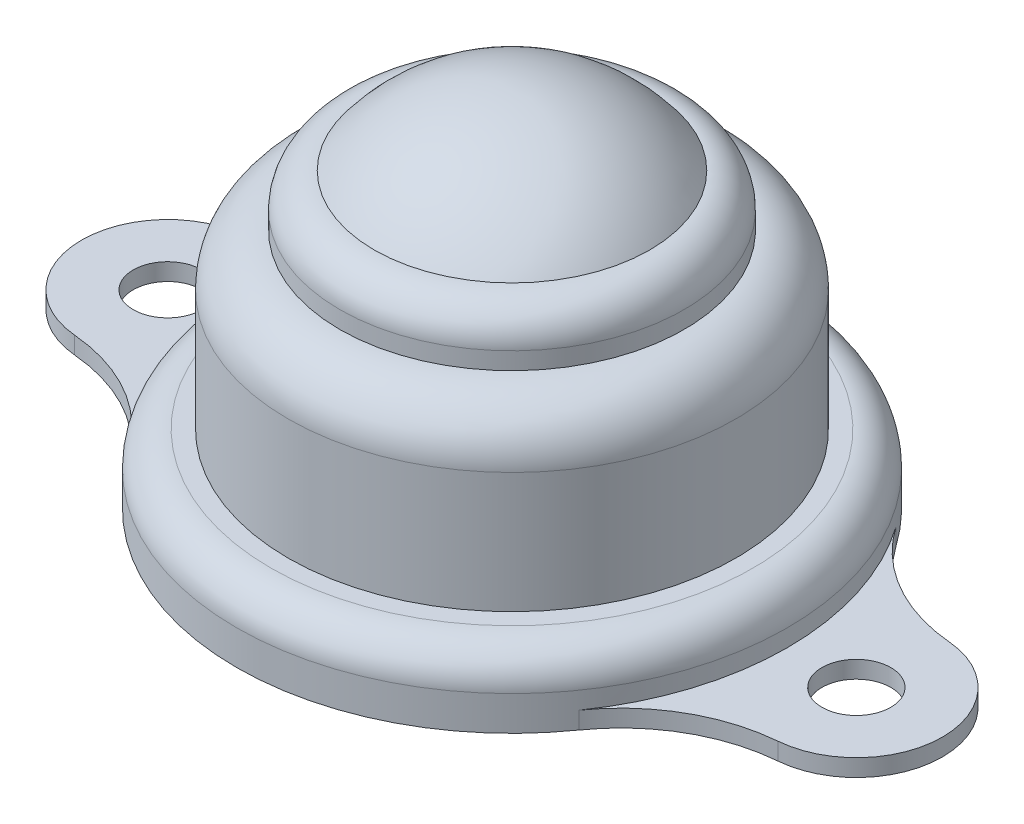
from build123d import *

# Parameters (mm, degrees)
SKETCH1_R           = 2
BOSS_EXTRUDE1_DEPTH = 1
SKETCH2_R           = 16
SKETCH2_R_2         = 13
BOSS_EXTRUDE2_DEPTH = 3
FILLET2_R           = 2
SKETCH3_R           = 13
SKETCH3_R_2         = 10
BOSS_EXTRUDE3_DEPTH = 10
SKETCH4_R           = 10
SKETCH4_R_2         = 8
BOSS_EXTRUDE4_DEPTH = 3
FILLET3_R           = 2
FILLET4_R           = 3


with BuildPart() as part:
    # Sketch1 → Boss-Extrude1 (new body)
    with BuildSketch(Plane(origin=(0, 0, 0), x_dir=(1, 0, 0), z_dir=(0, 1, 0))):
        with BuildLine():
            ThreePointArc((-20.425, 4.981904756), (-25, 0), (-20.425, -4.981904756))
            ThreePointArc((-20.425, -4.981904756), (-16.291035329, -6.276222002), (-13.092307692, -9.197362627))
            ThreePointArc((-13.092307692, -9.197362627), (0, -16), (13.092307692, -9.197362627))
            ThreePointArc((13.092307692, -9.197362627), (16.291035329, -6.276222002), (20.425, -4.981904756))
            ThreePointArc((20.425, -4.981904756), (25, 0), (20.425, 4.981904756))
            ThreePointArc((20.425, 4.981904756), (16.291035329, 6.276222002), (13.092307692, 9.197362627))
            ThreePointArc((13.092307692, 9.197362627), (0, 16), (-13.092307692, 9.197362627))
            ThreePointArc((-13.092307692, 9.197362627), (-16.291035329, 6.276222002), (-20.425, 4.981904756))
        make_face()
        with Locations(Location((-20, 0, 0), (0, 0, 270))):
            Circle(SKETCH1_R, mode=Mode.SUBTRACT)
        with Locations(Location((20, 0, 0), (0, 0, 270))):
            Circle(SKETCH1_R, mode=Mode.SUBTRACT)
    extrude(amount=BOSS_EXTRUDE1_DEPTH)

    # Sketch2 → Boss-Extrude2 (add)
    with BuildSketch(Plane(origin=(0, 1, 0), x_dir=(1, 0, 0), z_dir=(0, 1, 0))):
        with Locations(Location((0, 0, 0), (0, 0, 35.08808946))):
            Circle(SKETCH2_R)
        with Locations(Location((0, 0, 0), (0, 0, 270))):
            Circle(SKETCH2_R_2, mode=Mode.SUBTRACT)
    extrude(amount=BOSS_EXTRUDE2_DEPTH)

    # Fillet2
    fillet2_edges = [part.edges().sort_by_distance(p)[0] for p in [
        (-13.092307692, 4, 9.197362627),
    ]]
    fillet(fillet2_edges, radius=FILLET2_R)


with BuildPart() as body_2:
    # Sketch3 → Boss-Extrude3 (new body)
    with BuildSketch(Plane(origin=(0, 4, 0), x_dir=(1, 0, 0), z_dir=(0, 1, 0))):
        with Locations(Location((0, 0, 0), (0, 0, 270))):
            Circle(SKETCH3_R)
        with Locations(Location((0, 0, 0), (0, 0, 270))):
            Circle(SKETCH3_R_2, mode=Mode.SUBTRACT)
    extrude(amount=BOSS_EXTRUDE3_DEPTH)

    # Fillet4
    fillet4_edges = [body_2.edges().sort_by_distance(p)[0] for p in [
        (0, 14, -13),
    ]]
    fillet(fillet4_edges, radius=FILLET4_R - 0.0001)  # a hair under: the kernel refuses the full size


with BuildPart() as body_3:
    # Sketch4 → Boss-Extrude4 (new body)
    with BuildSketch(Plane(origin=(0, 14, 0), x_dir=(1, 0, 0), z_dir=(0, 1, 0))):
        with Locations(Location((0, 0, 0), (0, 0, 270))):
            Circle(SKETCH4_R)
        with Locations(Location((0, 0, 0), (0, 0, 270))):
            Circle(SKETCH4_R_2, mode=Mode.SUBTRACT)
    extrude(amount=BOSS_EXTRUDE4_DEPTH)

    # Fillet3
    fillet3_edges = [body_3.edges().sort_by_distance(p)[0] for p in [
        (0, 17, -10),
    ]]
    fillet(fillet3_edges, radius=FILLET3_R - 0.0001)  # a hair under: the kernel refuses the full size

    # Sketch5 → Revolve2 (revolve)
    with BuildSketch(Plane.XY):
        with BuildLine():
            Line((0, 1), (0, 21))
            ThreePointArc((0, 21), (-10, 11), (0, 1))
        make_face()
    revolve(axis=Axis((0, 1, 0), (0, 1, 0)))


solid = Compound([part.part, body_2.part, body_3.part])
